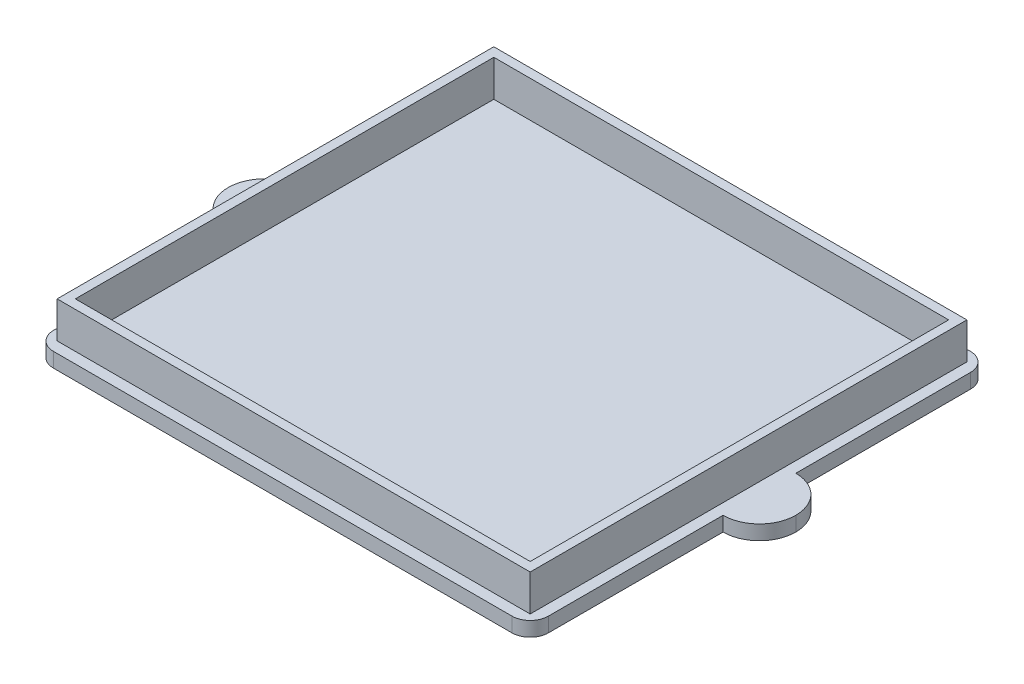
from build123d import *

# Parameters (mm, degrees)
BOSS_EXTRUDE1_DEPTH = 4
SKETCH3_W           = 130
SKETCH3_H           = 120
SKETCH3_W_2         = 125
SKETCH3_H_2         = 115
BOSS_EXTRUDE2_DEPTH = 10
FILLET1_R           = 5
FILLET2_R           = 10


with BuildPart() as part:
    # Sketch1 → Boss-Extrude1 (new body)
    with BuildSketch(Plane(origin=(0, 0, 0), x_dir=(1, 0, 0), z_dir=(0, 1, 0))):
        Polygon((-68, 63), (68, 63), (68, 39.979206653), (68, 10), (78, 10), (78, -10), (68, -10), (68, -63), (-68, -63), (-68, -10), (-78, -10), (-78, 10), (-68, 10), (-68, 39.979206653), align=None)
    extrude(amount=BOSS_EXTRUDE1_DEPTH)

    # Sketch3 → Boss-Extrude2 (add)
    with BuildSketch(Plane(origin=(0, 4, 0), x_dir=(1, 0, 0), z_dir=(0, 1, 0))):
        Rectangle(SKETCH3_W, SKETCH3_H)
        Rectangle(SKETCH3_W_2, SKETCH3_H_2, mode=Mode.SUBTRACT)
    extrude(amount=BOSS_EXTRUDE2_DEPTH)

    # Fillet1
    fillet1_edges = [part.edges().sort_by_distance(p)[0] for p in [
        (68, 2, 63),
        (-68, 2, 63),
        (-68, 2, -63),
        (68, 2, -63),
    ]]
    fillet(fillet1_edges, radius=FILLET1_R)

    # Fillet2
    fillet2_edges = [part.edges().sort_by_distance(p)[0] for p in [
        (78, 2, -10),
        (78, 2, 10),
        (-78, 2, 10),
        (-78, 2, -10),
    ]]
    fillet(fillet2_edges, radius=FILLET2_R - 0.0001)  # a hair under: the kernel refuses the full size


solid = part.part
